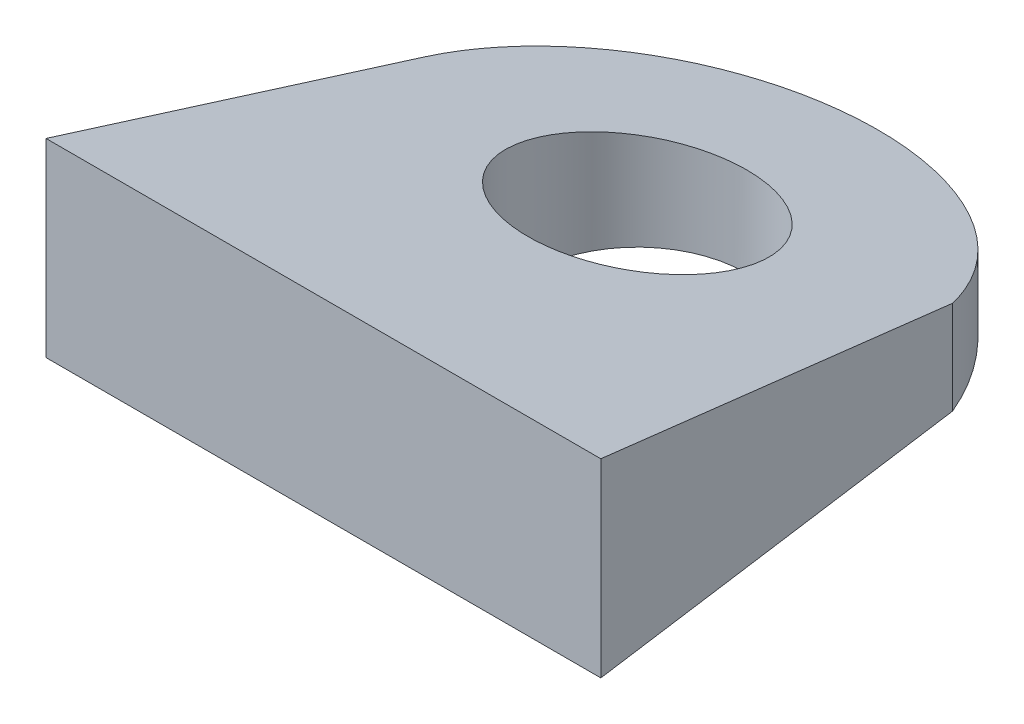
from build123d import *

# Parameters (mm, degrees)
SKETCH1_R               = 1.905
BOSS_EXTRUDE3_DEPTH     = 3.302
BOUNDARY_CUT1_START     = 3.213111109
BOUNDARY_CUT1_OUTLINE_W = 12
BOUNDARY_CUT1_OUTLINE_H = 13
BOUNDARY_CUT1_DEPTH     = 2.224461537


# Read off the part's stored shape, not the designer's step: Boundary-Cut1
with BuildPart() as part:
    # Sketch1 → Boss-Extrude3 (new body)
    with BuildSketch(Plane(origin=(0, 0, 0), x_dir=(1, 0, 0), z_dir=(0, 1, 0))):
        with BuildLine():
            Line((0, 0), (-4.826, 0))
            Line((-4.826, 0), (-4.165178795, 5.925506842))
            ThreePointArc((-4.165178795, 5.925506842), (-2.7944349, 8.584397923), (0, 9.652))
            ThreePointArc((0, 9.652), (2.321880516, 8.950033085), (3.865959408, 7.079282688))
            Line((3.865959408, 7.079282688), (4.826, 0))
            Line((4.826, 0), (0, 0))
        make_face()
        with Locations(Location((0, 5.461, 0), (0, 0, 90))):
            Circle(SKETCH1_R, mode=Mode.SUBTRACT)
    extrude(amount=BOSS_EXTRUDE3_DEPTH)

    # Boundary-Cut1 outline → Boundary-Cut1 (cut)
    with BuildSketch(Plane(origin=(0, 0, 0), x_dir=(1, 0, 0), z_dir=(0, 0.9730802874900094, -0.23046638387921312)).offset(BOUNDARY_CUT1_START)):
        with Locations((0, 4.5)):
            Rectangle(BOUNDARY_CUT1_OUTLINE_W, BOUNDARY_CUT1_OUTLINE_H)
    extrude(amount=BOUNDARY_CUT1_DEPTH, mode=Mode.SUBTRACT)


solid = part.part
